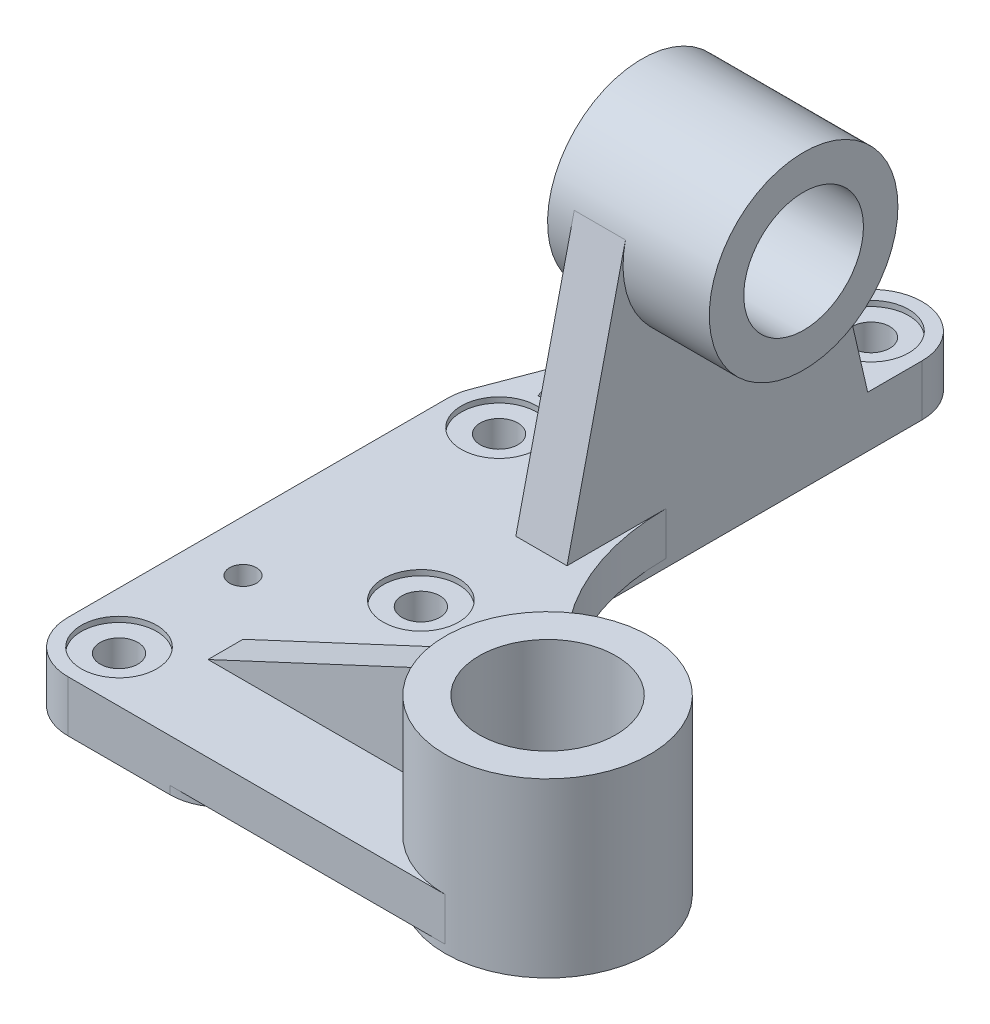
from build123d import *
from build123d.topology import SkipClean

# Parameters (mm, degrees)
BOSS_EXTRUDE1_DEPTH                     = 19
SKETCH1_3_R                             = 25.38
BOSS_EXTRUDE2_DEPTH                     = 64
BOSS_EXTRUDE3_DEPTH                     = 19
BOSS_EXTRUDE4_DEPTH                     = 32
BOSS_EXTRUDE4_DEPTH_BACK                = 28
SKETCH2_3_R                             = 22.205
RIB1_REACH                              = 282.601
SKETCH3_WALL_W                          = 623.410253716
SKETCH3_WALL_H                          = 13
RIB6_REACH                              = 322.877
SKETCH4_WALL_W                          = 733.669507052
SKETCH4_WALL_H                          = 13
CBORE_FOR_M5_HEX_HEAD_BOLT1_D           = 14
CBORE_FOR_M5_HEX_HEAD_BOLT1_CBORE_D     = 28
CBORE_FOR_M5_HEX_HEAD_BOLT1_CBORE_DEPTH = 2
F_10_0MM_DOWEL_HOLE1_D                  = 10
CUT_EXTRUDE1_DEPTH                      = 3
FILLET1_R                               = 19


with BuildPart() as part:
    # Sketch1 → Boss-Extrude1 (new body)
    with BuildSketch(Plane(origin=(0, 0, 0), x_dir=(1, 0, 0), z_dir=(0, 1, 0))):
        with BuildLine():
            Line((-140, -38), (0, -38))
            ThreePointArc((0, -38), (-37.989390575, 0.897888482), (1.795275591, 37.957568225))
            ThreePointArc((1.795275591, 37.957568225), (-58.401942798, 65.430265218), (-83, 126.858188541))
            Line((-83, 126.858188541), (-83, 222))
            ThreePointArc((-83, 222), (-98.569028752, 240.687654649), (-119.760888031, 228.749137452))
            Line((-119.760888031, 228.749137452), (-157.760888031, 128.749137452))
            ThreePointArc((-157.760888031, 128.749137452), (-158.687654649, 125.430971248), (-159, 122))
            Line((-159, 122), (-159, -19))
            ThreePointArc((-159, -19), (-153.435028843, -32.435028843), (-140, -38))
        make_face()
    extrude(amount=BOSS_EXTRUDE1_DEPTH)

    # Sketch1<3> → Boss-Extrude2 (add)
    with BuildSketch(Plane(origin=(0, 0, 0), x_dir=(1, 0, 0), z_dir=(0, 1, 0))):
        with BuildLine():
            ThreePointArc((1.795275591, 37.957568225), (-37.989390575, 0.897888482), (0, -38))
            ThreePointArc((0, -38), (26.870057685, -26.870057685), (38, 0))
            ThreePointArc((38, 0), (27.497458723, 26.227652655), (1.795275591, 37.957568225))
        make_face()
        Circle(SKETCH1_3_R, mode=Mode.SUBTRACT)
    extrude(amount=BOSS_EXTRUDE2_DEPTH)

    # Sketch2 → Boss-Extrude3 (add)
    with BuildSketch(Plane(origin=(-83, 0, 0), x_dir=(0, 0, -1), z_dir=(1, 0, 0))):
        with BuildLine():
            Line((111.897047733, 112.873286902), (90.22469179, 19))
            Line((90.22469179, 19), (126.858188541, 19))
            Line((126.858188541, 19), (201.77530821, 19))
            Line((201.77530821, 19), (180.102952267, 112.873286902))
            ThreePointArc((180.102952267, 112.873286902), (180.775014949, 108.962112482), (181, 105))
            ThreePointArc((181, 105), (142.037887518, 70.224985051), (111.897047733, 112.873286902))
        make_face()
    extrude(amount=-BOSS_EXTRUDE3_DEPTH)

    # Sketch2<3> → Boss-Extrude4 (add, two sides: drawn at the far end of the back side and taken through both)
    with BuildSketch(Plane(origin=(-83, 0, 0), x_dir=(0, 0, -1), z_dir=(1, 0, 0)).offset(-BOSS_EXTRUDE4_DEPTH_BACK)):
        with BuildLine():
            ThreePointArc((180.102952267, 112.873286902), (146, 140), (111.897047733, 112.873286902))
            ThreePointArc((111.897047733, 112.873286902), (142.037887518, 70.224985051), (181, 105))
            ThreePointArc((181, 105), (180.775014949, 108.962112482), (180.102952267, 112.873286902))
        make_face()
        with Locations((146, 105)):
            Circle(SKETCH2_3_R, mode=Mode.SUBTRACT)
    extrude(amount=BOSS_EXTRUDE4_DEPTH + BOSS_EXTRUDE4_DEPTH_BACK)

    # Sketch3 wall → Rib1 (add, up to next)
    with BuildSketch(Plane(origin=(-127, 44.5, -146), x_dir=(-0.531491071064, -0.847063894508, 0), z_dir=(0.847063894508, -0.531491071064, 0)), mode=Mode.PRIVATE) as rib1_sk1:
        Rectangle(SKETCH3_WALL_W, SKETCH3_WALL_H)
    rib1_tool1 = extrude(rib1_sk1.sketch, amount=RIB1_REACH, mode=Mode.PRIVATE) - part.part
    add(rib1_tool1.solids().sort_by_distance((-127, 44.5, -146))[0])

    # Sketch4 wall → Rib6 (add, up to next)
    with BuildSketch(Plane(origin=(-78.745631489, 38, 0), x_dir=(-0.906307787036, -0.422618261742, 0), z_dir=(0.422618261742, -0.906307787036, 0)), mode=Mode.PRIVATE) as rib6_sk1:
        Rectangle(SKETCH4_WALL_W, SKETCH4_WALL_H)
    rib6_tool1 = extrude(rib6_sk1.sketch, amount=RIB6_REACH, mode=Mode.PRIVATE) - part.part
    add(rib6_tool1.solids().sort_by_distance((-78.745631489, 38, 0))[0])

    # CBORE for M5 Hex Head Bolt1 (through all)
    with Locations(Plane(origin=(0, 19, 0), x_dir=(1, 0, 0), z_dir=(0, 1, 0))):
        with Locations((-140, -19), (-140, 122), (-102, 222), (-99, 52)):
            CounterBoreHole(CBORE_FOR_M5_HEX_HEAD_BOLT1_D / 2, CBORE_FOR_M5_HEX_HEAD_BOLT1_CBORE_D / 2, CBORE_FOR_M5_HEX_HEAD_BOLT1_CBORE_DEPTH)

    # Ø10.0mm Dowel Hole1 (through all)
    with Locations(Plane(origin=(0, 19, 0), x_dir=(1, 0, 0), z_dir=(0, 1, 0))):
        with Locations((-140, 27), (-115, 197)):
            Hole(F_10_0MM_DOWEL_HOLE1_D / 2)

    # Sketch14 → Cut-Extrude1 (cut)
    with SkipClean():  # the faces are left unmerged after this step: merging them gives an invalid solid
        with BuildSketch(Plane.XZ):
            with BuildLine():
                Line((-83, -126.858188541), (-83, 38))
                Line((-83, 38), (0, 38))
                ThreePointArc((0, 38), (-37.989390575, -0.897888482), (1.795275591, -37.957568225))
                ThreePointArc((1.795275591, -37.957568225), (-58.401942798, -65.430265218), (-83, -126.858188541))
            make_face()
        extrude(amount=-CUT_EXTRUDE1_DEPTH, mode=Mode.SUBTRACT)

    # Fillet1
    fillet1_edges = [part.edges().sort_by_distance(p)[0] for p in [
        (-83, 1.5, 38),
    ]]
    fillet(fillet1_edges, radius=FILLET1_R)


solid = part.part
